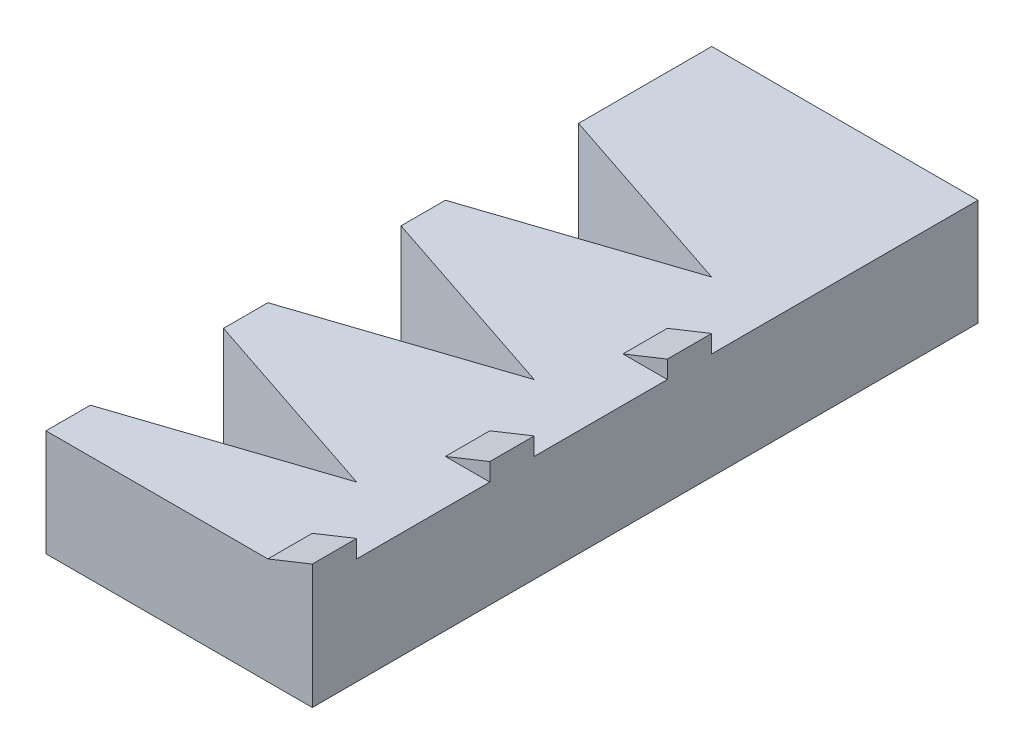
from build123d import *

# Parameters (mm, degrees)
SKETCH1_W           = 30
SKETCH1_H           = 75
BOSS_EXTRUDE1_DEPTH = 12
CUT_EXTRUDE1_DEPTH  = 12
LPATTERN1_COUNT     = 3
LPATTERN1_PITCH     = 20
BOUNDARY1_START     = -45
BOUNDARY1_DEPTH     = 5
LPATTERN2_COUNT     = 3
LPATTERN2_PITCH     = 20


# Read off the part's stored shape, not the designer's step: Boundary1
with BuildPart() as part:
    # Sketch1 → Boss-Extrude1 (new body)
    with BuildSketch(Plane(origin=(0, 0, 0), x_dir=(1, 0, 0), z_dir=(0, 1, 0))):
        with Locations((15, 37.5)):
            Rectangle(SKETCH1_W, SKETCH1_H)
    extrude(amount=BOSS_EXTRUDE1_DEPTH)

    # Sketch3 → Cut-Extrude1 (cut)
    with BuildSketch(Plane(origin=(0, 0, 0), x_dir=(1, 0, 0), z_dir=(0, 1, 0))):
        Polygon((0, 5), (22.5, 12.5), (0, 20), align=None)
    cut_extrude1 = extrude(amount=CUT_EXTRUDE1_DEPTH, mode=Mode.SUBTRACT)

    # LPattern1: Cut-Extrude1 ×3
    with Locations(*[(0, 0, -i * LPATTERN1_PITCH) for i in range(1, LPATTERN1_COUNT)]):
        add(cut_extrude1, mode=Mode.SUBTRACT)

    # Boundary1 outline → Boundary1 (add)
    with BuildSketch(Plane.XY.offset(BOUNDARY1_START)):
        Polygon((30, 14), (25, 12), (30, 12), align=None)
    boundary1 = extrude(amount=BOUNDARY1_DEPTH)

    # LPattern2: Boundary1 ×3
    with Locations(*[(0, 0, i * LPATTERN2_PITCH) for i in range(1, LPATTERN2_COUNT)]):
        add(boundary1)


solid = part.part
